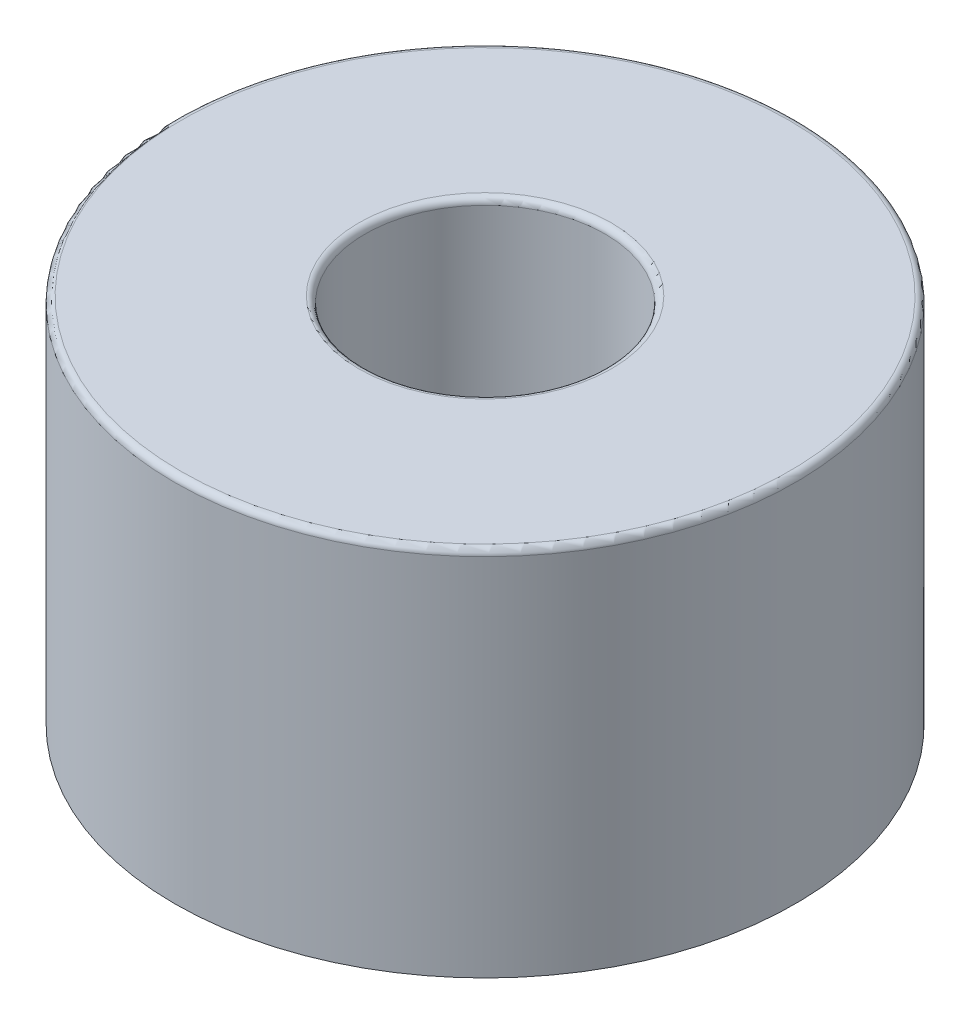
from build123d import *

# Parameters (mm, degrees)
SKETCH1_R           = 12.319
SKETCH1_R_2         = 4.7625
BOSS_EXTRUDE1_DEPTH = 14.732
FILLET1_R           = 0.254


with BuildPart() as part:
    # Sketch1 → Boss-Extrude1 (new body)
    with BuildSketch(Plane(origin=(0, 0, 0), x_dir=(1, 0, 0), z_dir=(0, 1, 0))):
        Circle(SKETCH1_R)
        Circle(SKETCH1_R_2, mode=Mode.SUBTRACT)
    extrude(amount=BOSS_EXTRUDE1_DEPTH)

    # Fillet1
    fillet1_edges = [part.edges().sort_by_distance(p)[0] for p in [
        (-4.7625, 14.732, 0),
        (-12.319, 14.732, 0),
    ]]
    fillet(fillet1_edges, radius=FILLET1_R)


solid = part.part
